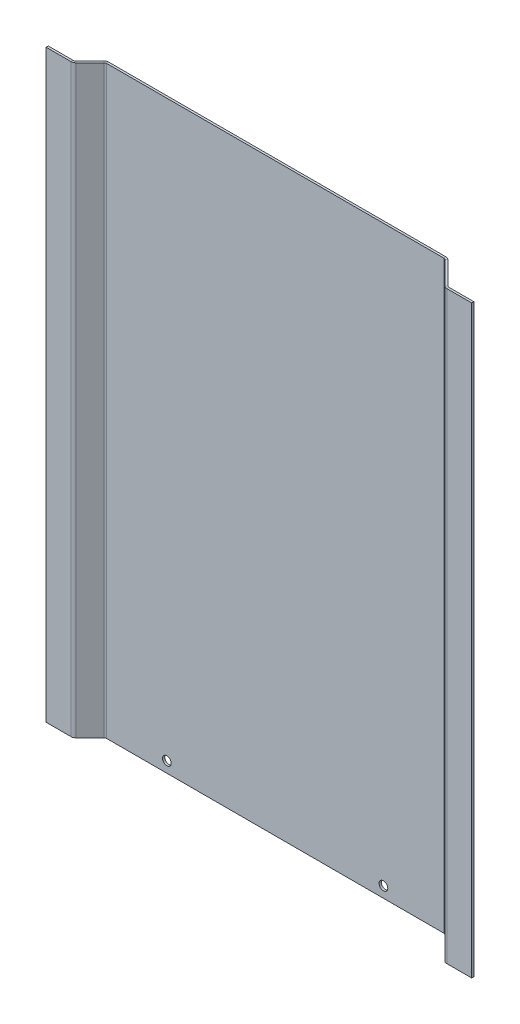
from build123d import *

# Parameters (mm, degrees)
SM_BASE_FLANGE_1_DEPTH = 270
SKETCH_2_R             = 2
CUT_EXTRUDE_1_DEPTH    = 10


# Sheet-metal steps are written as plain solids
with BuildPart() as part:
    # Sketch 1 → Базовая кромка1 (new body)
    with BuildSketch(Plane(origin=(0, 0, 0), x_dir=(1, 0, 0), z_dir=(0, 1, 0))):
        with BuildLine():
            Line((-190.103499123, -50.5), (-178.600555398, -50.5))
            ThreePointArc((-178.600555398, -50.5), (-178.141335279, -50.408655439), (-177.75202726, -50.148528137))
            Line((-177.75202726, -50.148528137), (-171.247864204, -43.644365081))
            ThreePointArc((-171.247864204, -43.644365081), (-170.534132837, -43.167465028), (-169.692229286, -43))
            Line((-169.692229286, -43), (-14.007193009, -43))
            ThreePointArc((-14.007193009, -43), (-13.165289458, -43.167465028), (-12.451558091, -43.644365081))
            Line((-12.451558091, -43.644365081), (-1.947395035, -54.148528137))
            ThreePointArc((-1.947395035, -54.148528137), (-1.558087016, -54.408655439), (-1.098866897, -54.5))
            Line((-1.098866897, -54.5), (10.404076828, -54.5))
            Line((10.404076828, -54.5), (10.404076828, -55.5))
            Line((10.404076828, -55.5), (-1.098866897, -55.5))
            ThreePointArc((-1.098866897, -55.5), (-1.940770449, -55.332534972), (-2.654501816, -54.855634919))
            Line((-2.654501816, -54.855634919), (-13.158664872, -44.351471863))
            ThreePointArc((-13.158664872, -44.351471863), (-13.547972891, -44.091344561), (-14.007193009, -44))
            Line((-14.007193009, -44), (-169.692229286, -44))
            ThreePointArc((-169.692229286, -44), (-170.151449405, -44.091344561), (-170.540757423, -44.351471863))
            Line((-170.540757423, -44.351471863), (-177.044920479, -50.855634919))
            ThreePointArc((-177.044920479, -50.855634919), (-177.758651847, -51.332534972), (-178.600555398, -51.5))
            Line((-178.600555398, -51.5), (-190.103499123, -51.5))
            Line((-190.103499123, -51.5), (-190.103499123, -50.5))
        make_face()
    extrude(amount=SM_BASE_FLANGE_1_DEPTH)

    # Эскиз2 → Вырез-Вытянуть1 (cut)
    with BuildSketch(Plane.XY.offset(44)):
        with Locations((-141.849711148, 5)):
            Circle(SKETCH_2_R)
        with Locations((-41.849711148, 5)):
            Circle(SKETCH_2_R)
    extrude(amount=-CUT_EXTRUDE_1_DEPTH, mode=Mode.SUBTRACT)


solid = part.part
